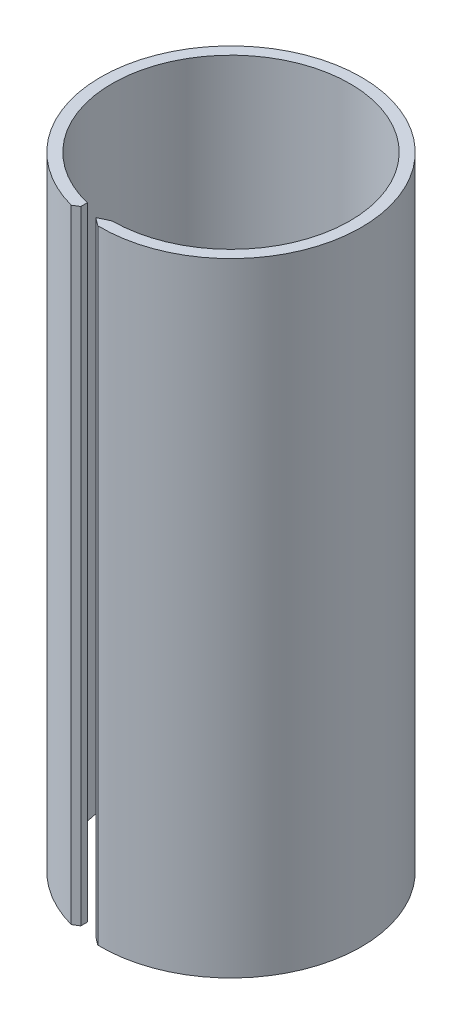
from build123d import *

# Parameters (mm, degrees)
BOSS_EXTRUDE1_DEPTH = 110


with BuildPart() as part:
    # Sketch1 → Boss-Extrude1 (new body)
    with BuildSketch(Plane(origin=(0, 0, 0), x_dir=(1, 0, 0), z_dir=(0, 1, 0))):
        with BuildLine():
            ThreePointArc((21, 0), (14.849242405, -14.849242405), (0, -21))
            Line((0, -21), (-1.935031911, -21.92807121))
            Line((-1.935031911, -21.92807121), (-0.517623397, -22.994174611))
            ThreePointArc((-0.517623397, -22.994174611), (16.079407046, -16.445445238), (23, 0))
            ThreePointArc((23, 0), (-13.976045966, 18.266640062), (-6.014794708, -22.1996001))
            Line((-6.014794708, -22.1996001), (-4.966780759, -21.551989097))
            Line((-4.966780759, -21.551989097), (-4.966780759, -20.404192924))
            ThreePointArc((-4.966780759, -20.404192924), (-12.97492975, 16.512153039), (21, 0))
        make_face()
    extrude(amount=BOSS_EXTRUDE1_DEPTH)


solid = part.part
